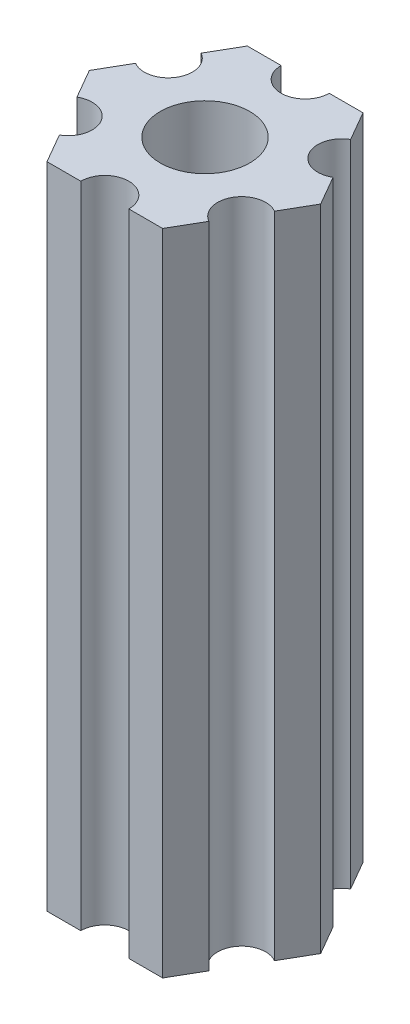
from build123d import *

# Parameters (mm, degrees)
ESBO_O1_R                = 2.79
RESSALTO_EXTRUS_O1_DEPTH = 40.5


with BuildPart() as part:
    # Esboço1 → Ressalto-extrusão1 (new body)
    with BuildSketch(Plane.XZ.offset(34.5)):
        with BuildLine():
            Line((77.062658774, 17.174038106), (78.116878365, 19))
            Line((78.116878365, 19), (77.062658774, 20.825961894))
            ThreePointArc((77.062658774, 20.825961894), (75.013620668, 21.375), (75.562658774, 23.424038106))
            Line((75.562658774, 23.424038106), (74.508439182, 25.25))
            Line((74.508439182, 25.25), (72.4, 25.25))
            ThreePointArc((72.4, 25.25), (70.9, 23.75), (69.4, 25.25))
            Line((69.4, 25.25), (67.291560818, 25.25))
            Line((67.291560818, 25.25), (66.237341226, 23.424038106))
            ThreePointArc((66.237341226, 23.424038106), (66.786379332, 21.375), (64.737341226, 20.825961894))
            Line((64.737341226, 20.825961894), (63.683121635, 19))
            Line((63.683121635, 19), (64.737341226, 17.174038106))
            ThreePointArc((64.737341226, 17.174038106), (66.786379332, 16.625), (66.237341226, 14.575961894))
            Line((66.237341226, 14.575961894), (67.291560818, 12.75))
            Line((67.291560818, 12.75), (69.4, 12.75))
            ThreePointArc((69.4, 12.75), (70.9, 14.25), (72.4, 12.75))
            Line((72.4, 12.75), (74.508439182, 12.75))
            Line((74.508439182, 12.75), (75.562658774, 14.575961894))
            ThreePointArc((75.562658774, 14.575961894), (75.013620668, 16.625), (77.062658774, 17.174038106))
        make_face()
        with Locations((70.9, 19)):
            Circle(ESBO_O1_R, mode=Mode.SUBTRACT)
    extrude(amount=-RESSALTO_EXTRUS_O1_DEPTH)


solid = part.part
